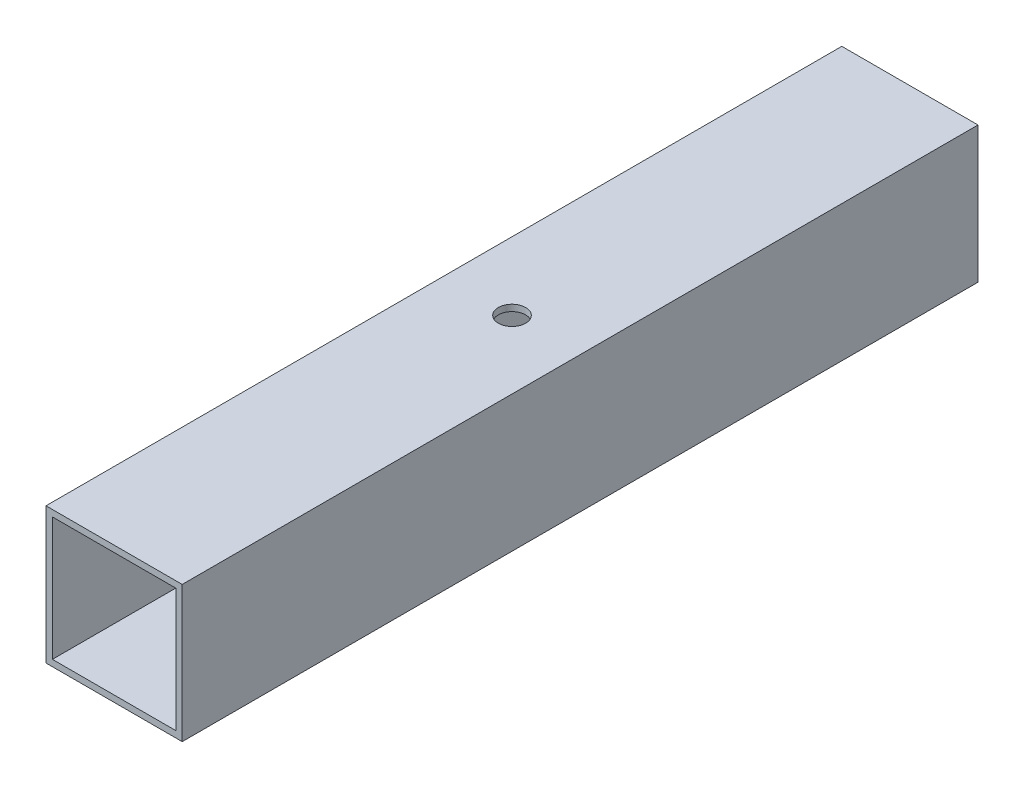
from build123d import *

# Parameters (mm, degrees)
SKETCH1_W           = 25.5
SKETCH1_H           = 25.5
SKETCH1_W_2         = 23.1
SKETCH1_H_2         = 23.1
BOSS_EXTRUDE1_DEPTH = 149
SKETCH2_R           = 2.56
CUT_EXTRUDE1_DEPTH  = 152.70304051


with BuildPart() as part:
    # Sketch1 → Boss-Extrude1 (new body)
    with BuildSketch(Plane.XY):
        Rectangle(SKETCH1_W, SKETCH1_H)
        Rectangle(SKETCH1_W_2, SKETCH1_H_2, mode=Mode.SUBTRACT)
    extrude(amount=BOSS_EXTRUDE1_DEPTH)

    # Sketch2 → Cut-Extrude1 (cut, through all)
    with BuildSketch(Plane(origin=(0, 12.75, 0), x_dir=(1, 0, 0), z_dir=(0, 1, 0))):
        with Locations((0, -74.5)):
            Circle(SKETCH2_R)
    extrude(amount=-CUT_EXTRUDE1_DEPTH, mode=Mode.SUBTRACT)


solid = part.part
